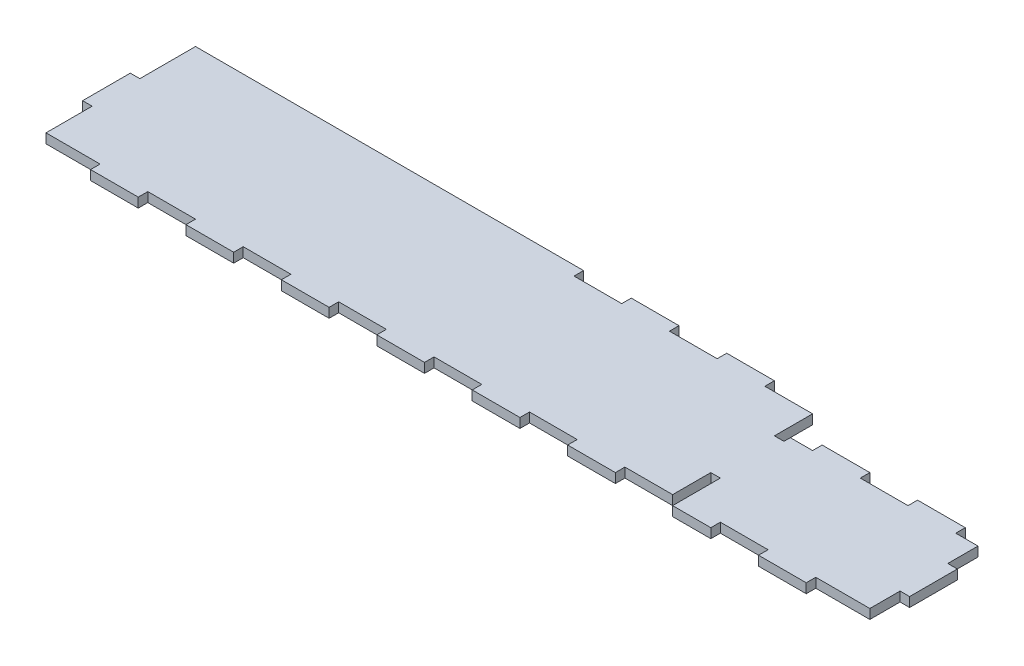
from build123d import *

# Parameters (mm, degrees)
SALIENTE_EXTRUIR1_DEPTH = 3


with BuildPart() as part:
    # Croquis1 → Saliente-Extruir1 (new body)
    with BuildSketch(Plane(origin=(0, 0, 0), x_dir=(1, 0, 0), z_dir=(0, 1, 0))):
        Polygon((125, 47), (125, 50), (110, 50), (95, 50), (80, 50), (65, 50), (50, 50), (35, 50), (20, 50), (3, 50), (3, 47), (3, 32.5), (0, 32.5), (0, 25), (0, 17.5), (3, 17.5), (3, 3), (20, 3), (20, 0), (35, 0), (35, 3), (50, 3), (50, 0), (65, 0), (65, 3), (80, 3), (80, 0), (95, 0), (95, 3), (110, 3), (110, 0), (125, 0), (125, 3), (140, 3), (140, 0), (155, 0), (155, 3), (170, 3), (170, 0), (185, 0), (185, 3), (197, 3), (200, 3), (200, 15), (203, 15), (203, 0), (215, 0), (215, 3), (230, 3), (230, 0), (245, 0), (245, 3), (262, 3), (262, 12.5), (265, 12.5), (265, 20), (265, 27.5), (262, 27.5), (262, 37), (255, 37), (255, 40), (240, 40), (240, 37), (225, 37), (225, 40), (210, 40), (210, 37), (203, 37), (203, 35), (200, 35), (200, 37), (200, 47), (196.5, 47), (185, 47), (185, 50), (170, 50), (170, 47), (155, 47), (155, 50), (140, 50), (140, 47), align=None)
    extrude(amount=SALIENTE_EXTRUIR1_DEPTH)


solid = part.part
